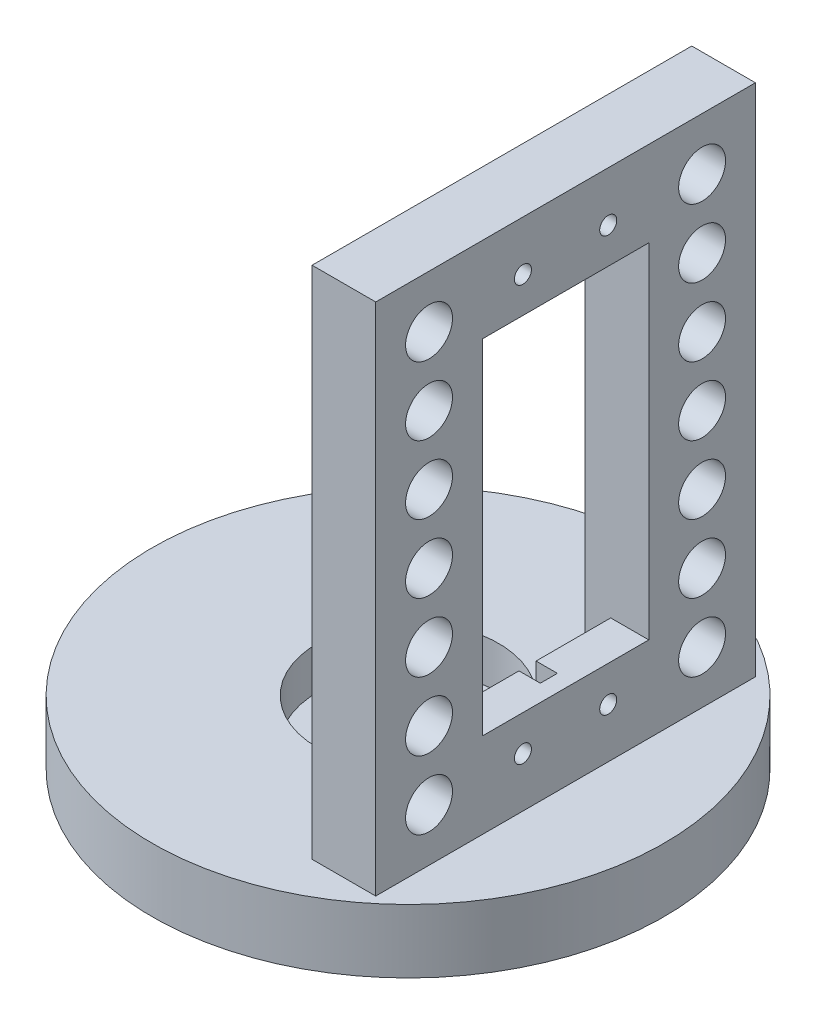
from build123d import *

# Parameters (mm, degrees)
SKETCH1_R           = 30
SKETCH1_R_2         = 1
SKETCH1_R_3         = 4.9
BOSS_EXTRUDE1_DEPTH = 7.46
SKETCH3_W           = 7.46
SKETCH3_H           = 44.5
BOSS_EXTRUDE2_DEPTH = 60.3
SKETCH4_R           = 1
SKETCH4_W           = 19.5
SKETCH4_H           = 40.3
CUT_EXTRUDE2_DEPTH  = 85.690126933
SKETCH5_R           = 10.6
CUT_EXTRUDE3_DEPTH  = 4.96
SKETCH6_W           = 19.5
SKETCH6_H           = 54
CUT_EXTRUDE4_DEPTH  = 3
SKETCH7_W           = 2
SKETCH7_H           = 6.85
CUT_EXTRUDE5_DEPTH  = 2.5
SKETCH8_R           = 2.75
CUT_EXTRUDE6_DEPTH  = 85.690126933


with BuildPart() as part:
    # Sketch1 → Boss-Extrude1 (new body)
    with BuildSketch(Plane(origin=(0, 0, 0), x_dir=(1, 0, 0), z_dir=(0, 1, 0))):
        Circle(SKETCH1_R)
        with Locations((7, 0)):
            Circle(SKETCH1_R_2, mode=Mode.SUBTRACT)
        with Locations((0, -7)):
            Circle(SKETCH1_R_2, mode=Mode.SUBTRACT)
        with Locations((-7, 0)):
            Circle(SKETCH1_R_2, mode=Mode.SUBTRACT)
        with Locations((0, 7)):
            Circle(SKETCH1_R_2, mode=Mode.SUBTRACT)
        Circle(SKETCH1_R_3, mode=Mode.SUBTRACT)
    extrude(amount=BOSS_EXTRUDE1_DEPTH)

    # Sketch3 → Boss-Extrude2 (add)
    with BuildSketch(Plane(origin=(0, 7.46, 0), x_dir=(1, 0, 0), z_dir=(0, 1, 0))):
        with Locations((14.73, 0)):
            Rectangle(SKETCH3_W, SKETCH3_H)
    extrude(amount=BOSS_EXTRUDE2_DEPTH)

    # Sketch4 → Cut-Extrude2 (cut, through all)
    with BuildSketch(Plane.ZY.offset(-11)):
        with Locations((-5, 61.93)):
            Circle(SKETCH4_R)
        with Locations((5, 61.93)):
            Circle(SKETCH4_R)
        with Locations((5, 13.29)):
            Circle(SKETCH4_R)
        with Locations((-5, 13.29)):
            Circle(SKETCH4_R)
        with Locations((0, 37.61)):
            Rectangle(SKETCH4_W, SKETCH4_H)
    extrude(amount=-CUT_EXTRUDE2_DEPTH, mode=Mode.SUBTRACT)

    # Sketch5 → Cut-Extrude3 (cut)
    with BuildSketch(Plane(origin=(0, 7.46, 0), x_dir=(1, 0, 0), z_dir=(0, 1, 0))):
        Circle(SKETCH5_R)
    extrude(amount=-CUT_EXTRUDE3_DEPTH, mode=Mode.SUBTRACT)

    # Sketch6 → Cut-Extrude4 (cut)
    with BuildSketch(Plane.ZY.offset(-11)):
        with Locations((0, 37.61)):
            Rectangle(SKETCH6_W, SKETCH6_H)
    extrude(amount=-CUT_EXTRUDE4_DEPTH, mode=Mode.SUBTRACT)

    # Sketch7 → Cut-Extrude5 (cut)
    with BuildSketch(Plane.ZY.offset(-14)):
        with Locations((0, 61.185)):
            Rectangle(SKETCH7_W, SKETCH7_H)
        with Locations((0, 14.035)):
            Rectangle(SKETCH7_W, SKETCH7_H)
    extrude(amount=-CUT_EXTRUDE5_DEPTH, mode=Mode.SUBTRACT)

    # Sketch8 → Cut-Extrude6 (cut, through all)
    with BuildSketch(Plane.ZY.offset(-11)):
        with Locations((-16, 37.61)):
            Circle(SKETCH8_R)
        with Locations((-16, 45.61)):
            Circle(SKETCH8_R)
        with Locations((-16, 53.61)):
            Circle(SKETCH8_R)
        with Locations((-16, 61.61)):
            Circle(SKETCH8_R)
        with Locations((-16, 13.61)):
            Circle(SKETCH8_R)
        with Locations((-16, 21.61)):
            Circle(SKETCH8_R)
        with Locations((-16, 29.61)):
            Circle(SKETCH8_R)
        with Locations((16, 29.61)):
            Circle(SKETCH8_R)
        with Locations((16, 21.61)):
            Circle(SKETCH8_R)
        with Locations((16, 13.61)):
            Circle(SKETCH8_R)
        with Locations((16, 61.61)):
            Circle(SKETCH8_R)
        with Locations((16, 53.61)):
            Circle(SKETCH8_R)
        with Locations((16, 45.61)):
            Circle(SKETCH8_R)
        with Locations((16, 37.61)):
            Circle(SKETCH8_R)
    extrude(amount=-CUT_EXTRUDE6_DEPTH, mode=Mode.SUBTRACT)


solid = part.part
